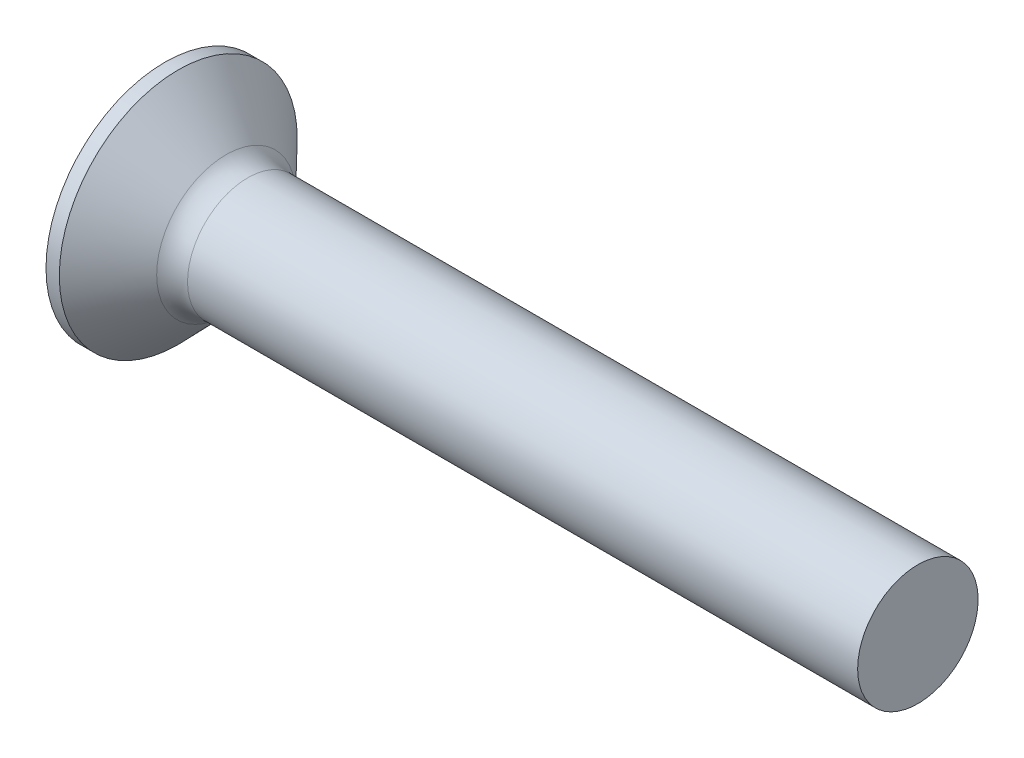
from build123d import *

# Parameters (mm, degrees)
FILLET1_R    = 2
RECPAT_COUNT = 2
RECPAT_ANGLE = 90


with BuildPart() as part:
    # BodySke → BaseBody (revolve)
    with BuildSketch(Plane.XY):
        Polygon((0, 0), (0, 7.9), (0.883813778, 7.9), (4.65, 4), (50, 4), (50, 0), align=None)
    revolve(axis=Axis((0, 0, 0), (1, 0, 0)))

    # Fillet1
    fillet1_edges = [part.edges().sort_by_distance(p)[0] for p in [
        (4.65, -4, 0),
    ]]
    fillet(fillet1_edges, radius=FILLET1_R)

    # RecSkeTop → Recess section 0
    with BuildSketch(Plane.ZY):
        with BuildLine():
            Line((-0.968, 4.4), (0.968, 4.4))
            Line((0.968, 4.4), (0.968, -4.4))
            Line((0.968, -4.4), (-0.968, -4.4))
            Line((-0.968, -4.4), (-0.968, 4.4))
        make_face()
    # RecSkeBot → Recess section 1
    with BuildSketch(Plane(origin=(4.96, 0, 0), x_dir=(0, 0, -1), z_dir=(1, 0, 0))):
        with BuildLine():
            Line((0.968, 1.927035638), (-0.968, 1.927035638))
            Line((-0.968, 1.927035638), (-0.968, -1.927035638))
            Line((-0.968, -1.927035638), (0.968, -1.927035638))
            Line((0.968, -1.927035638), (0.968, 1.927035638))
        make_face()
    recess = loft(mode=Mode.SUBTRACT)

    # RecPat: Recess ×2 about axis
    recpat_axis = Axis((0, 0, 0), (1, 0, 0))
    for i in range(1, RECPAT_COUNT):
        add(recess.rotate(recpat_axis, i * RECPAT_ANGLE / (RECPAT_COUNT - 1)), mode=Mode.SUBTRACT)

    # RecCorSke → RecessCore (revolve, cut)
    with BuildSketch(Plane.XY):
        Polygon((0, 0), (0, 2.1296), (4.96, 1.782763013), (5.539254817, 0), align=None)
    revolve(axis=Axis((0, 0, 0), (1, 0, 0)), mode=Mode.SUBTRACT)


solid = part.part
